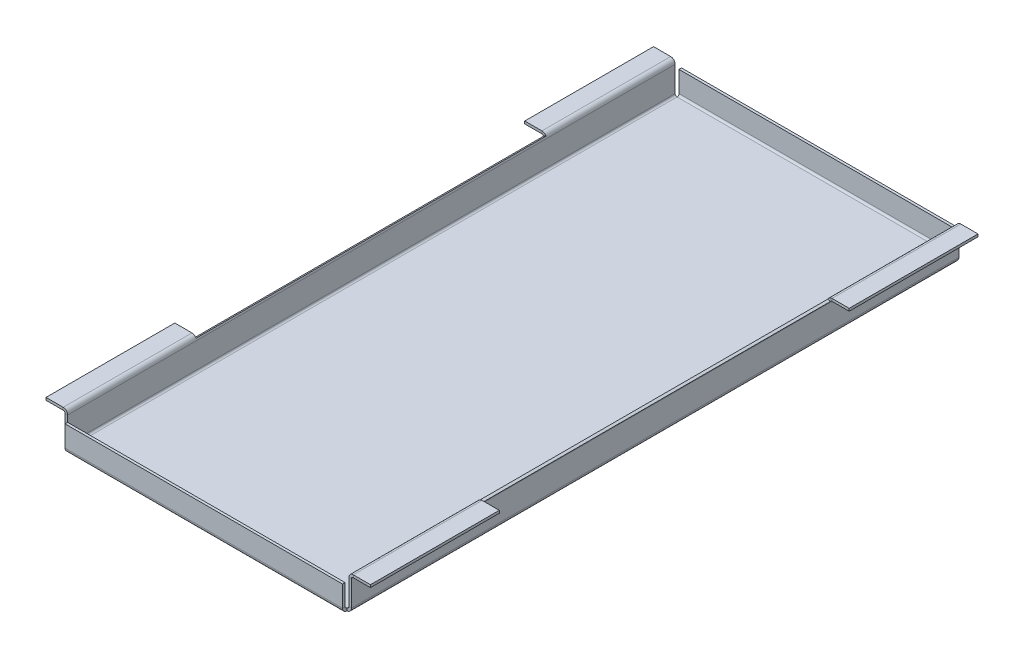
from build123d import *

# Parameters (mm, degrees)
BASE_FLANGIA1_DEPTH       = 477.5
BORDO_FLANGIA1_DEPTH      = 436
BORDO_FLANGIA1_BEND_DEPTH = 436
TAGLIO_ESTRUSIONE2_START  = -275
TAGLIO_ESTRUSIONE2_DEPTH  = 550


# Read off the part's stored shape, not the designer's step: Taglio-Estrusione2
# Sheet-metal steps are written as plain solids
with BuildPart() as part:
    # Schizzo1 → Base-Flangia1 (new, symmetric)
    with BuildSketch(Plane.XY):
        with BuildLine():
            Line((-255, 50), (-228, 50))
            ThreePointArc((-228, 50), (-225.878679656, 49.121320344), (-225, 47))
            Line((-225, 47), (-225, 7))
            ThreePointArc((-225, 7), (-222.949747468, 2.050252532), (-218, 0))
            Line((-218, 0), (218, 0))
            ThreePointArc((218, 0), (222.949747468, 2.050252532), (225, 7))
            Line((225, 7), (225, 47))
            ThreePointArc((225, 47), (225.878679656, 49.121320344), (228, 50))
            Line((228, 50), (255, 50))
            Line((255, 50), (255, 54))
            Line((255, 54), (228, 54))
            ThreePointArc((228, 54), (223.050252532, 51.949747468), (221, 47))
            Line((221, 47), (221, 7))
            ThreePointArc((221, 7), (220.121320344, 4.878679656), (218, 4))
            Line((218, 4), (-218, 4))
            ThreePointArc((-218, 4), (-220.121320344, 4.878679656), (-221, 7))
            Line((-221, 7), (-221, 47))
            ThreePointArc((-221, 47), (-223.050252532, 51.949747468), (-228, 54))
            Line((-228, 54), (-255, 54))
            Line((-255, 54), (-255, 50))
        make_face()
    extrude(amount=BASE_FLANGIA1_DEPTH, both=True)

    # Bordo-Flangia1 section (across the edge) → Bordo-Flangia1 (add)
    with BuildSketch(Plane(origin=(-218, 4, 480.5), x_dir=(0, 0, -1), z_dir=(1, 0, 0))):
        with BuildLine():
            Line((-4, 3), (-4, 36))
            Line((-4, 36), (0, 36))
            Line((0, 36), (0, 3))
            ThreePointArc((0, 3), (0.878679656, 0.878679656), (3, 0))
            Line((3, 0), (3, -4))
            ThreePointArc((3, -4), (-1.949747468, -1.949747468), (-4, 3))
        make_face()
    extrude(amount=BORDO_FLANGIA1_DEPTH)

    # Bordo-Flangia1 section 2 (across the edge) → Bordo-Flangia1 bend (add)
    with BuildSketch(Plane(origin=(218, 4, -480.5), x_dir=(0, 0, 1), z_dir=(-1, 0, 0))):
        with BuildLine():
            Line((-4, 3), (-4, 36))
            Line((-4, 36), (0, 36))
            Line((0, 36), (0, 3))
            ThreePointArc((0, 3), (0.878679656, 0.878679656), (3, 0))
            Line((3, 0), (3, -4))
            ThreePointArc((3, -4), (-1.949747468, -1.949747468), (-4, 3))
        make_face()
    extrude(amount=BORDO_FLANGIA1_BEND_DEPTH)

    # Taglio-Estrusione2 outline → Taglio-Estrusione2 (cut)
    with BuildSketch(Plane.XY.offset(TAGLIO_ESTRUSIONE2_START)):
        with BuildLine():
            ThreePointArc((-228, 50), (-226.396432548, 49.535462765), (-225.289476291, 48.285714286))
            Line((-225.289476291, 48.285714286), (-221.67544468, 50))
            ThreePointArc((-221.67544468, 50), (-224.258342614, 52.916079783), (-228, 54))
            Line((-228, 54), (-255, 54))
            Line((-255, 54), (-255, 50))
            Line((-255, 50), (-228, 50))
        make_face()
        with BuildLine():
            ThreePointArc((228, 54), (224.258342614, 52.916079783), (221.67544468, 50))
            Line((221.67544468, 50), (225.289476291, 48.285714286))
            ThreePointArc((225.289476291, 48.285714286), (226.396432548, 49.535462765), (228, 50))
            Line((228, 50), (255, 50))
            Line((255, 50), (255, 54))
            Line((255, 54), (228, 54))
        make_face()
    extrude(amount=TAGLIO_ESTRUSIONE2_DEPTH, mode=Mode.SUBTRACT)


solid = part.part
